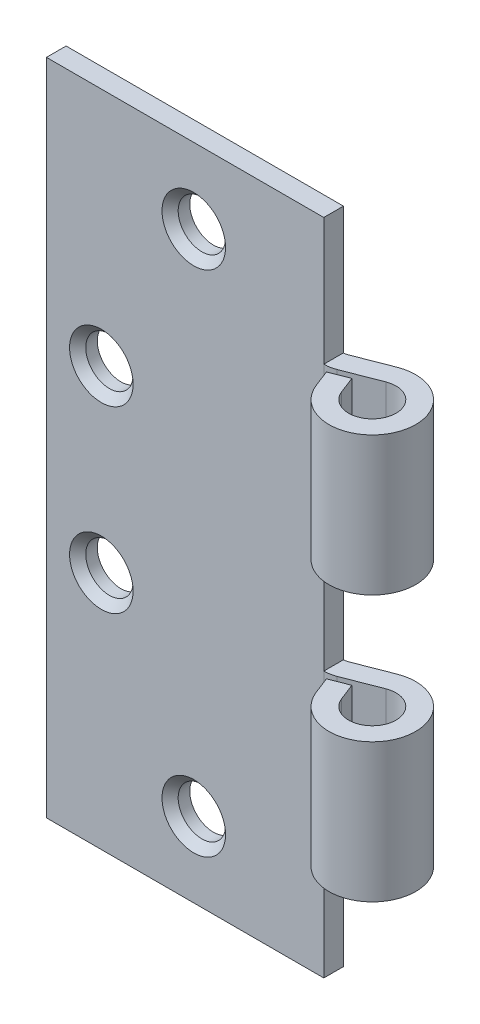
from build123d import *

# Parameters (mm, degrees)
BODYS_W                        = 48
BODYS_H                        = 114
BODY_DEPTH                     = 1.7
MIRROR1_START                  = -1.7
MIRROR1_OUTLINE_R              = 4.1
MIRROR1_DEPTH                  = 3.4
KNUCKLEBODY_REACH              = 63.87
KNUCKLEBODY_DIRECTION_2_REACH  = 63.87
KNUCKLECUT_DEPTH               = 71.965414111
KNUCKLECUT_DEPTH_BACK          = 71.965414111
KNUCKLECUTS_W                  = 17
KNUCKLECUTS_H                  = 22
HOLECHAMFER_SIZE               = 1.4
F_11_0_11_DIAMETER_HOLE2_D     = 11
F_11_0_11_DIAMETER_HOLE2_DEPTH = 4
F_11_0_11_DIAMETER_HOLE2_TIP   = 3.304733405


# Read off the part's stored shape, not the designer's step: Mirror1
with BuildPart() as part:
    # BodyS → Body (new, symmetric)
    with BuildSketch(Plane.XY):
        Rectangle(BODYS_W, BODYS_H)
    extrude(amount=BODY_DEPTH, both=True)

    # Mirror1 outline → Mirror1 (cut)
    with BuildSketch(Plane.XY.offset(MIRROR1_START)):
        with Locations((-14.5, 15.5)):
            Circle(MIRROR1_OUTLINE_R)
        with Locations((1.5, 44)):
            Circle(MIRROR1_OUTLINE_R)
        with Locations((-14.5, -15.5)):
            Circle(MIRROR1_OUTLINE_R)
        with Locations((1.5, -44)):
            Circle(MIRROR1_OUTLINE_R)
    extrude(amount=MIRROR1_DEPTH, mode=Mode.SUBTRACT)

    # KnuckleBody: up to this face of the body (flat: up to its plane)
    knucklebody_end = Plane(part.part.faces().sort_by_distance((0, 57, 0))[0])
    # KnuckleBodyS → KnuckleBody (add, up to the picked face)
    with BuildSketch(Plane(origin=(0, 0, 0), x_dir=(1, 0, 0), z_dir=(0, 1, 0)), mode=Mode.PRIVATE) as knucklebody_sk1:
        with BuildLine():
            Line((25.386415094, -2.62754717), (28.555471698, -1.395849057))
            Line((28.555471698, -1.395849057), (29.678490566, -4.285283019))
            ThreePointArc((29.678490566, -4.285283019), (37.25246893, -4.451961541), (32.014716981, 1.021509434))
            Line((32.014716981, 1.021509434), (25.956226415, -1.333207547))
            ThreePointArc((25.956226415, -1.333207547), (24.995158089, -1.607509809), (24, -1.7))
            Line((24, -1.7), (24, 1.7))
            ThreePointArc((24, 1.7), (24.36857707, 1.734255626), (24.724528302, 1.835849057))
            Line((24.724528302, 1.835849057), (30.783018868, 4.190566038))
            ThreePointArc((30.783018868, 4.190566038), (40.364272432, -5.821880867), (26.509433962, -5.516981132))
            Line((26.509433962, -5.516981132), (25.386415094, -2.62754717))
        make_face()
    knucklebody_tool1 = split(extrude(knucklebody_sk1.sketch, amount=KNUCKLEBODY_REACH, mode=Mode.PRIVATE), bisect_by=knucklebody_end, keep=Keep.BOTH, mode=Mode.PRIVATE)
    add(knucklebody_tool1.solids().sort_by(Axis((26.159241, 0, 3.990133), (0, 1, 0)))[0])

    # KnuckleBody direction 2: up to this face of the body (flat: up to its plane)
    knucklebody_direction_2_end = Plane(part.part.faces().sort_by_distance((0, -57, 0))[0])
    # KnuckleBodyS → KnuckleBody direction 2 (add, up to the picked face)
    with BuildSketch(Plane(origin=(0, 0, 0), x_dir=(1, 0, 0), z_dir=(0, 1, 0)), mode=Mode.PRIVATE) as knucklebody_direction_2_sk1:
        with BuildLine():
            Line((25.386415094, -2.62754717), (28.555471698, -1.395849057))
            Line((28.555471698, -1.395849057), (29.678490566, -4.285283019))
            ThreePointArc((29.678490566, -4.285283019), (37.25246893, -4.451961541), (32.014716981, 1.021509434))
            Line((32.014716981, 1.021509434), (25.956226415, -1.333207547))
            ThreePointArc((25.956226415, -1.333207547), (24.995158089, -1.607509809), (24, -1.7))
            Line((24, -1.7), (24, 1.7))
            ThreePointArc((24, 1.7), (24.36857707, 1.734255626), (24.724528302, 1.835849057))
            Line((24.724528302, 1.835849057), (30.783018868, 4.190566038))
            ThreePointArc((30.783018868, 4.190566038), (40.364272432, -5.821880867), (26.509433962, -5.516981132))
            Line((26.509433962, -5.516981132), (25.386415094, -2.62754717))
        make_face()
    knucklebody_direction_2_tool1 = split(extrude(knucklebody_direction_2_sk1.sketch, amount=-KNUCKLEBODY_DIRECTION_2_REACH, mode=Mode.PRIVATE), bisect_by=knucklebody_direction_2_end, keep=Keep.BOTH, mode=Mode.PRIVATE)
    add(knucklebody_direction_2_tool1.solids().sort_by(Axis((26.159241, 0, 3.990133), (0, -1, 0)))[0])

    # KnuckleCutS → KnuckleCut (cut, two sides: drawn at the far end of the back side and taken through both)
    with BuildSketch(Plane.XY.offset(-KNUCKLECUT_DEPTH_BACK)):
        with Locations((32.5, 46)):
            Rectangle(KNUCKLECUTS_W, KNUCKLECUTS_H)
        with Locations((32.5, -46)):
            Rectangle(KNUCKLECUTS_W, KNUCKLECUTS_H)
        with Locations((32.5, 0)):
            Rectangle(KNUCKLECUTS_W, KNUCKLECUTS_H)
    extrude(amount=KNUCKLECUT_DEPTH + KNUCKLECUT_DEPTH_BACK, mode=Mode.SUBTRACT)

    # HoleChamfer
    holechamfer_edges = [part.edges().sort_by_distance(p)[0] for p in [
        (-18.6, 15.5, 1.7),
        (-2.6, 44, 1.7),
        (-18.6, -15.5, 1.7),
        (-2.6, -44, 1.7),
    ]]
    chamfer(holechamfer_edges, length=HOLECHAMFER_SIZE)

    # Ø11.0 (11) Diameter Hole2
    with Locations(Plane(origin=(0, -35, 0), x_dir=(-1, 0, 0), z_dir=(0, -1, 0))):
        with Locations((-33.5, -2.8)):
            Hole(F_11_0_11_DIAMETER_HOLE2_D / 2, depth=F_11_0_11_DIAMETER_HOLE2_DEPTH)
            with Locations((0, 0, -(F_11_0_11_DIAMETER_HOLE2_DEPTH + F_11_0_11_DIAMETER_HOLE2_TIP / 2))):  # 118° drill point
                Cone(0, F_11_0_11_DIAMETER_HOLE2_D / 2, F_11_0_11_DIAMETER_HOLE2_TIP, mode=Mode.SUBTRACT)


solid = part.part
